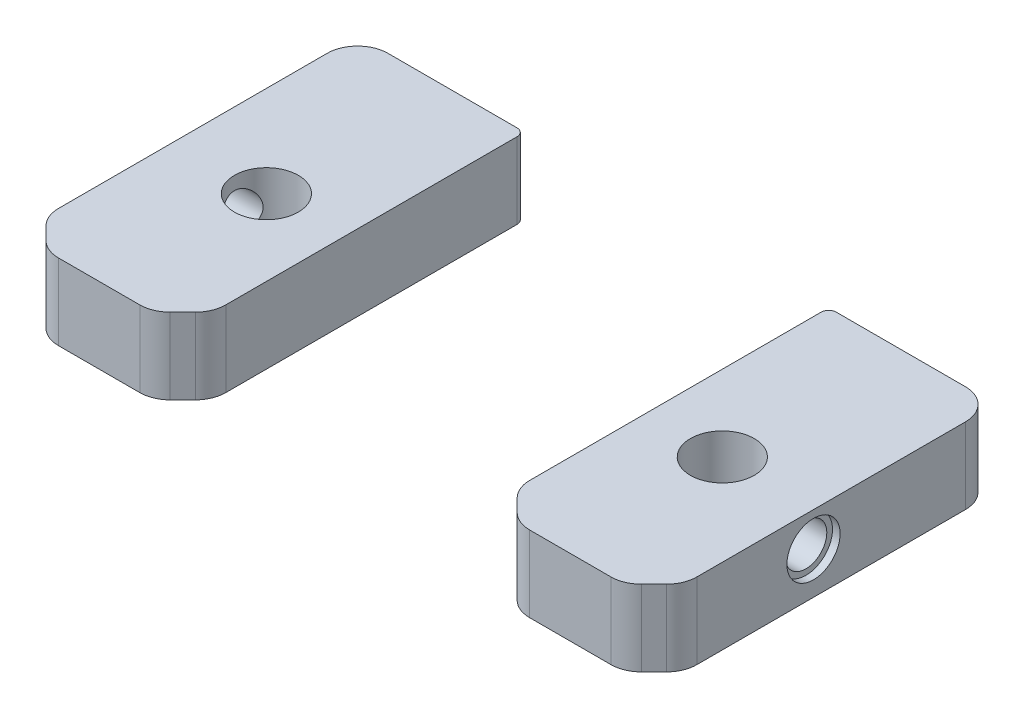
from build123d import *

# Parameters (mm, degrees)
ESQUISSE1_R                 = 4.2
BOSS_EXTRU_1_DEPTH          = 10
CHANFREIN3_SIZE             = 4
CONG_2_R                    = 4
ESQUISSE3_R                 = 4
BOSS_EXTRU_2_DEPTH          = 2
BOSS_EXTRU_2_2_DEPTH        = 2
ENL_V_START                 = -42
ENL_V_MAT_EXTRU_4_OUTLINE_R = 2.75
ENL_V_MAT_EXTRU_4_DEPTH     = 8.825492271
CONG_4_R                    = 4
ESQUISSE7_R                 = 2.75
ENL_V_MAT_EXTRU_5_DEPTH     = 8.5
ESQUISSE7_4_R               = 3.5
ESQUISSE7_4_R_2             = 2.75
ENL_V_MAT_EXTRU_8_DEPTH     = 1
ESQUISSE8_R                 = 3.5
ENL_V_MAT_EXTRU_9_DEPTH     = 1
ENL_V_START_2               = -1
ESQUISSE9_R                 = 3.5
ENL_V_MAT_EXTRU_10_DEPTH    = 1
ESQUISSE10_W                = 40
ESQUISSE10_H                = 50.736146746
ENL_V_MAT_EXTRU_11_DEPTH    = 10
CONG_5_R                    = 1
CONG_6_R                    = 1


# Read off the part's stored shape, not the designer's step: Enlèv. mat.-Extru.4
with BuildPart() as part:
    # Esquisse1 → Boss.-Extru.1 (new body)
    # profile 1 of 4: a face of its own
    with BuildSketch(Plane(origin=(0, 0, 0), x_dir=(1, 0, 0), z_dir=(0, 1, 0))):
        Polygon((-20, 10.5), (-20, 16), (-20, 17.5), (-15, 17.5), (0, 17.5), (0, 24), (-42, 24), (-42, 16), (-42, 0), (-42, -21), (-20, -21), align=None)
        with Locations(Location((-30, 0, 0), (0, 0, 270))):
            Circle(ESQUISSE1_R, mode=Mode.SUBTRACT)
    # profile 2 of 4: a face of its own
    with BuildSketch(Plane(origin=(0, 0, 0), x_dir=(1, 0, 0), z_dir=(0, 1, 0))):
        Polygon((0, 24), (0, 17.5), (15, 17.5), (20, 17.5), (20, 16), (20, 10.5), (20, -21), (42, -21), (42, 0), (42, 16), (42, 24), align=None)
        with Locations(Location((30, 0, 0), (0, 0, 270))):
            Circle(ESQUISSE1_R, mode=Mode.SUBTRACT)
    # profile 3 of 4: a face of its own
    with BuildSketch(Plane(origin=(0, 0, 0), x_dir=(1, 0, 0), z_dir=(0, 1, 0))):
        Polygon((-20, 17.5), (-20, 16), (-20, 10.5), (-15, 17.5), align=None)
    # profile 4 of 4: a face of its own
    with BuildSketch(Plane(origin=(0, 0, 0), x_dir=(1, 0, 0), z_dir=(0, 1, 0))):
        Polygon((20, 17.5), (15, 17.5), (20, 10.5), (20, 16), align=None)
    extrude(amount=BOSS_EXTRU_1_DEPTH)

    # Chanfrein3
    chanfrein3_edges = [part.edges().sort_by_distance(p)[0] for p in [
        (-20, 5, 21),
        (-42, 5, 21),
        (42, 5, 21),
        (20, 5, 21),
    ]]
    chamfer(chanfrein3_edges, length=CHANFREIN3_SIZE)

    # Congé2
    cong_2_edges = [part.edges().sort_by_distance(p)[0] for p in [
        (42, 5, 17),
        (24, 5, 21),
        (38, 5, 21),
        (20, 5, 17),
        (-24, 5, 21),
        (-38, 5, 21),
        (-42, 5, 17),
        (-20, 5, 17),
    ]]
    fillet(cong_2_edges, radius=CONG_2_R)

    # Enlèv. mat.-Extru.4 outline → Enlèv. mat.-Extru.4 (cut)
    with BuildSketch(Plane.YZ.offset(ENL_V_START)):
        with Locations((5.5, 0)):
            Circle(ENL_V_MAT_EXTRU_4_OUTLINE_R)
    enl_v_mat_extru_4 = extrude(amount=ENL_V_MAT_EXTRU_4_DEPTH, mode=Mode.SUBTRACT)

    # Symétrie10: Enlèv. mat.-Extru.4 across plane
    add(enl_v_mat_extru_4.mirror(Plane(origin=(0, 0, 0), x_dir=(0, 0, 1), z_dir=(1, 0, 0))), mode=Mode.SUBTRACT)

    # Congé4
    cong_4_edges = [part.edges().sort_by_distance(p)[0] for p in [
        (-42, 5, -24),
        (42, 5, -24),
        (20, 5, -10.5),
        (15, 5, -17.5),
        (-15, 5, -17.5),
        (-20, 5, -10.5),
    ]]
    fillet(cong_4_edges, radius=CONG_4_R)

    # Esquisse7 → Enlèv. mat.-Extru.5 (cut)
    with BuildSketch(Plane.XZ):
        with Locations(Location((-35, -17, 0), (0, 0, 270))):
            Circle(ESQUISSE7_R)
        with Locations(Location((35, -17, 0), (0, 0, 270))):
            Circle(ESQUISSE7_R)
    extrude(amount=-ENL_V_MAT_EXTRU_5_DEPTH, mode=Mode.SUBTRACT)

    # Esquisse7<4> → Enlèv. mat.-Extru.8 (cut)
    # profile 1 of 2: a face of its own
    with BuildSketch(Plane.XZ):
        with Locations(Location((-35, -17, 0), (0, 0, 270))):
            Circle(ESQUISSE7_4_R)
        with Locations(Location((-35, -17, 0), (0, 0, 270))):
            Circle(ESQUISSE7_4_R_2, mode=Mode.SUBTRACT)
    # profile 2 of 2: a face of its own
    with BuildSketch(Plane.XZ):
        with Locations(Location((35, -17, 0), (0, 0, 270))):
            Circle(ESQUISSE7_4_R)
        with Locations(Location((35, -17, 0), (0, 0, 270))):
            Circle(ESQUISSE7_4_R_2, mode=Mode.SUBTRACT)
    extrude(amount=-ENL_V_MAT_EXTRU_8_DEPTH, mode=Mode.SUBTRACT)

    # Esquisse8 → Enlèv. mat.-Extru.9 (cut)
    with BuildSketch(Plane.ZY.offset(42)):
        with Locations((0, 5.5)):
            Circle(ESQUISSE8_R)
    extrude(amount=-ENL_V_MAT_EXTRU_9_DEPTH, mode=Mode.SUBTRACT)

    # Esquisse9 → Enlèv. mat.-Extru.10 (cut)
    with BuildSketch(Plane(origin=(42, 0, 0), x_dir=(0, 0, -1), z_dir=(1, 0, 0)).offset(ENL_V_START_2)):
        with Locations(Location((0, 5.5, 0), (0, 0, 180))):
            Circle(ESQUISSE9_R)
    extrude(amount=ENL_V_MAT_EXTRU_10_DEPTH, mode=Mode.SUBTRACT)

    # Esquisse10 → Enlèv. mat.-Extru.11 (cut)
    with BuildSketch(Plane(origin=(0, 10, 0), x_dir=(1, 0, 0), z_dir=(0, 1, 0))):
        Rectangle(ESQUISSE10_W, ESQUISSE10_H)
    extrude(amount=-ENL_V_MAT_EXTRU_11_DEPTH, mode=Mode.SUBTRACT)


with BuildPart() as body_2:
    # Esquisse3 → Boss.-Extru.2 (new body)
    with BuildSketch(Plane.XZ):
        with Locations(Location((-30, 0, 0), (0, 0, 270))):
            Circle(ESQUISSE3_R)
    extrude(amount=-BOSS_EXTRU_2_DEPTH)


with BuildPart() as body_3:
    # Esquisse3 → Boss.-Extru.2 2 (new body)
    with BuildSketch(Plane.XZ):
        with Locations(Location((30, 0, 0), (0, 0, 90))):
            Circle(ESQUISSE3_R)
    extrude(amount=-BOSS_EXTRU_2_2_DEPTH)


with BuildPart() as enl_v_mat_extru_11_piece_1:
    # of the separate pieces the step leaves, piece 1, a body of its own (enl_v_mat_extru_11_pieces)
    add(part.part.solids().sort_by_distance((-42, 0, -20))[0])

    # Congé5
    cong_5_edges = [enl_v_mat_extru_11_piece_1.edges().sort_by_distance(p)[0] for p in [
        (-20, 5, -24),
    ]]
    fillet(cong_5_edges, radius=CONG_5_R)


with BuildPart() as enl_v_mat_extru_11_piece_2:
    # of the separate pieces the step leaves, piece 2, a body of its own (enl_v_mat_extru_11_pieces)
    add(part.part.solids().sort_by_distance((20, 0, -24))[0])

    # Congé6
    cong_6_edges = [enl_v_mat_extru_11_piece_2.edges().sort_by_distance(p)[0] for p in [
        (20, 5, -24),
    ]]
    fillet(cong_6_edges, radius=CONG_6_R)


solid = Compound([body_2.part, body_3.part, enl_v_mat_extru_11_piece_1.part, enl_v_mat_extru_11_piece_2.part])
